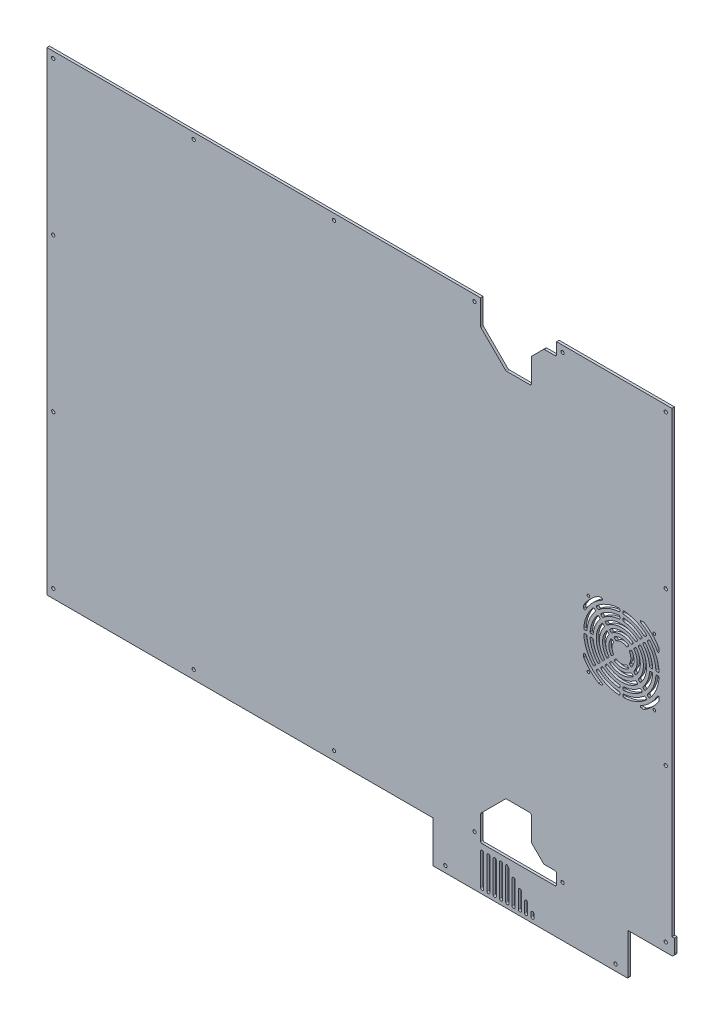
from build123d import *

# Parameters (mm, degrees)
EXTRUDE_1_DEPTH     = 4
CUT_EXTRUDE_6_DEPTH = 1249.406984921
SKETCH_2_R          = 2.6
CUT_EXTRUDE_1_DEPTH = 1249.406984921
CUT_EXTRUDE_2_DEPTH = 1249.406984921
EXTRUDE_2_DEPTH     = 4
SKETCH_4_R          = 2.6
CUT_EXTRUDE_3_DEPTH = 1249.406984921
FILLET_1_R          = 2.5
FILLET_2_R          = 1.5
FILLET_3_R          = 5.5
FILLET_4_R          = 2.5
SKETCH_6_R          = 2.1
CUT_EXTRUDE_5_DEPTH = 1249.406984921
FILLET_5_R          = 1.5


with BuildPart() as part:
    # Эскиз1 → Бобышка-Вытянуть1 (new body)
    with BuildSketch(Plane.XY):
        Polygon((0, -4), (0, 750), (994, 750), (994, 22.45), (998, 22.45), (998, -4), (924, -4), (924, -70), (613.5, -70), (613.5, -4), align=None)
    extrude(amount=EXTRUDE_1_DEPTH)

    # Эскиз7 → Вырез-Вытянуть6 (cut, through all)
    with BuildSketch(Plane.XY.offset(4)):
        Polygon((689.6, -0.4), (810.4, -0.4), (810.4, 20.4), (790.165685425, 20.4), (770.4, 40.165685425), (770.4, 80.4), (729.834314575, 80.4), (689.6, 40.165685425), align=None)
        Polygon((689.6, 750.4), (689.6, 709.834314575), (729.834314575, 669.6), (770.4, 669.6), (770.4, 709.834314575), (790.165685425, 729.6), (810.4, 729.6), (810.4, 750.4), align=None)
    extrude(amount=-CUT_EXTRUDE_6_DEPTH, mode=Mode.SUBTRACT)

    # Эскиз2 → Вырез-Вытянуть1 (cut, through all)
    with BuildSketch(Plane(origin=(0, 0, 0), x_dir=(-1, 0, 0), z_dir=(0, 0, -1))):
        with Locations((-10, 10)):
            Circle(SKETCH_2_R)
        with Locations((-10, 253.33)):
            Circle(SKETCH_2_R)
        with Locations((-10, 496.66)):
            Circle(SKETCH_2_R)
        with Locations((-10, 739.99)):
            Circle(SKETCH_2_R)
        with Locations((-984, 10)):
            Circle(SKETCH_2_R)
        with Locations((-984, 253.33)):
            Circle(SKETCH_2_R)
        with Locations((-984, 496.66)):
            Circle(SKETCH_2_R)
        with Locations((-984, 739.99)):
            Circle(SKETCH_2_R)
        with Locations((-820, 739.99)):
            Circle(SKETCH_2_R)
        with Locations((-820, 10)):
            Circle(SKETCH_2_R)
        with Locations((-233.33, 10)):
            Circle(SKETCH_2_R)
        with Locations((-233.33, 739.99)):
            Circle(SKETCH_2_R)
        with Locations((-456.66, 10)):
            Circle(SKETCH_2_R)
        with Locations((-456.66, 739.99)):
            Circle(SKETCH_2_R)
        with Locations((-679.99, 10)):
            Circle(SKETCH_2_R)
        with Locations((-679.99, 739.99)):
            Circle(SKETCH_2_R)
    extrude(amount=-CUT_EXTRUDE_1_DEPTH, mode=Mode.SUBTRACT)

    # Эскиз3 → Вырез-Вытянуть2 (cut, through all)
    with BuildSketch(Plane.XY.offset(4)):
        with BuildLine():
            Line((774.5, -62), (774.5, -12))
            ThreePointArc((774.5, -12), (772, -9.5), (769.5, -12))
            Line((769.5, -12), (769.5, -62))
            ThreePointArc((769.5, -62), (772, -64.5), (774.5, -62))
        make_face()
        with BuildLine():
            Line((759.5, -12), (759.5, -62))
            ThreePointArc((759.5, -62), (762, -64.5), (764.5, -62))
            Line((764.5, -62), (764.5, -12))
            ThreePointArc((764.5, -12), (762, -9.5), (759.5, -12))
        make_face()
        with BuildLine():
            Line((749.5, -12), (749.5, -62))
            ThreePointArc((749.5, -62), (752, -64.5), (754.5, -62))
            Line((754.5, -62), (754.5, -12))
            ThreePointArc((754.5, -12), (752, -9.5), (749.5, -12))
        make_face()
        with BuildLine():
            Line((739.5, -12), (739.5, -62))
            ThreePointArc((739.5, -62), (742, -64.5), (744.5, -62))
            Line((744.5, -62), (744.5, -12))
            ThreePointArc((744.5, -12), (742, -9.5), (739.5, -12))
        make_face()
        with BuildLine():
            Line((729.5, -12), (729.5, -62))
            ThreePointArc((729.5, -62), (732, -64.5), (734.5, -62))
            Line((734.5, -62), (734.5, -12))
            ThreePointArc((734.5, -12), (732, -9.5), (729.5, -12))
        make_face()
        with BuildLine():
            Line((719.5, -12), (719.5, -62))
            ThreePointArc((719.5, -62), (722, -64.5), (724.5, -62))
            Line((724.5, -62), (724.5, -12))
            ThreePointArc((724.5, -12), (722, -9.5), (719.5, -12))
        make_face()
        with BuildLine():
            Line((709.5, -12), (709.5, -62))
            ThreePointArc((709.5, -62), (712, -64.5), (714.5, -62))
            Line((714.5, -62), (714.5, -12))
            ThreePointArc((714.5, -12), (712, -9.5), (709.5, -12))
        make_face()
        with BuildLine():
            Line((699.5, -12), (699.5, -62))
            ThreePointArc((699.5, -62), (702, -64.5), (704.5, -62))
            Line((704.5, -62), (704.5, -12))
            ThreePointArc((704.5, -12), (702, -9.5), (699.5, -12))
        make_face()
        with BuildLine():
            Line((689.5, -12), (689.5, -62))
            ThreePointArc((689.5, -62), (692, -64.5), (694.5, -62))
            Line((694.5, -62), (694.5, -12))
            ThreePointArc((694.5, -12), (692, -9.5), (689.5, -12))
        make_face()
    extrude(amount=-CUT_EXTRUDE_2_DEPTH, mode=Mode.SUBTRACT)

    # Эскиз5 → Бобышка-Вытянуть2 (add)
    with BuildSketch(Plane.XY.offset(4)):
        Polygon((730, -8), (784.5, -8), (784.5, -66), align=None)
    extrude(amount=-EXTRUDE_2_DEPTH)

    # Эскиз4 → Вырез-Вытянуть3 (cut, through all)
    with BuildSketch(Plane.XY.offset(4)):
        with Locations((904, -60)):
            Circle(SKETCH_4_R)
        with Locations((633.5, -60)):
            Circle(SKETCH_4_R)
    extrude(amount=-CUT_EXTRUDE_3_DEPTH, mode=Mode.SUBTRACT)

    # Скругление1
    fillet_1_edges = [part.edges().sort_by_distance(p)[0] for p in [
        (689.6, -0.4, 2),
        (689.6, 40.165685425, 2),
        (729.834314575, 80.4, 2),
        (770.4, 80.4, 2),
        (770.4, 40.165685425, 2),
        (790.165685425, 20.4, 2),
        (810.4, 20.4, 2),
        (810.4, -0.4, 2),
        (689.6, 709.834314575, 2),
        (810.4, 729.6, 2),
        (790.165685425, 729.6, 2),
        (770.4, 709.834314575, 2),
        (770.4, 669.6, 2),
        (729.834314575, 669.6, 2),
    ]]
    fillet(fillet_1_edges, radius=FILLET_1_R)

    # Скругление2
    fillet_2_edges = [part.edges().sort_by_distance(p)[0] for p in [
        (924, -70, 2),
        (613.5, -70, 2),
    ]]
    fillet(fillet_2_edges, radius=FILLET_2_R)

    # Скругление3
    fillet_3_edges = [part.edges().sort_by_distance(p)[0] for p in [
        (998, -4, 2),
    ]]
    fillet(fillet_3_edges, radius=FILLET_3_R)

    # Скругление4
    fillet_4_edges = [part.edges().sort_by_distance(p)[0] for p in [
        (764.5, -44.71559633, 2),
        (759.5, -39.394495413, 2),
        (754.5, -34.073394495, 2),
        (749.5, -28.752293578, 2),
        (739.5, -18.110091743, 2),
        (744.5, -23.431192661, 2),
        (769.5, -50.036697248, 2),
        (774.5, -55.357798165, 2),
    ]]
    fillet(fillet_4_edges, radius=FILLET_4_R - 0.0001)  # a hair under: the kernel refuses the full size

    # Эскиз6 → Вырез-Вытянуть5 (cut, through all)
    with BuildSketch(Plane.XY.offset(4)):
        with Locations((861, 425.5)):
            Circle(SKETCH_6_R)
        with Locations((966, 425.5)):
            Circle(SKETCH_6_R)
        with Locations((966, 320.5)):
            Circle(SKETCH_6_R)
        with Locations((861, 320.5)):
            Circle(SKETCH_6_R)
        with BuildLine():
            Line((901.273982715, 381.690483379), (897.701017847, 385.263448247))
            ThreePointArc((897.701017847, 385.263448247), (893.5, 373), (897.701017847, 360.736551753))
            Line((897.701017847, 360.736551753), (901.273982715, 364.309516621))
            ThreePointArc((901.273982715, 364.309516621), (898.5, 373), (901.273982715, 381.690483379))
        make_face()
        with BuildLine():
            Line((894.143173948, 388.821292146), (890.59281489, 392.371651204))
            ThreePointArc((890.59281489, 392.371651204), (883.5, 373), (890.59281489, 353.628348796))
            Line((890.59281489, 353.628348796), (894.143173948, 357.178707854))
            ThreePointArc((894.143173948, 357.178707854), (888.5, 373), (894.143173948, 388.821292146))
        make_face()
        with BuildLine():
            Line((887.046710974, 395.91775512), (883.50325857, 399.461207524))
            ThreePointArc((883.50325857, 399.461207524), (873.5, 373), (883.50325857, 346.538792476))
            Line((883.50325857, 346.538792476), (887.046710974, 350.08224488))
            ThreePointArc((887.046710974, 350.08224488), (878.5, 373), (887.046710974, 395.91775512))
        make_face()
        with BuildLine():
            Line((879.961570479, 403.002895615), (876.421115817, 406.543350277))
            ThreePointArc((876.421115817, 406.543350277), (867.306023374, 392.134171618), (863.562539111, 375.5))
            Line((863.562539111, 375.5), (868.569498111, 375.5))
            ThreePointArc((868.569498111, 375.5), (871.925421037, 390.220754456), (879.961570479, 403.002895615))
        make_face()
        with BuildLine():
            Line((879.961570479, 342.997104385), (876.421115817, 339.456649723))
            ThreePointArc((876.421115817, 339.456649723), (867.306023374, 353.865828382), (863.562539111, 370.5))
            Line((863.562539111, 370.5), (868.569498111, 370.5))
            ThreePointArc((868.569498111, 370.5), (871.925421037, 355.779245544), (879.961570479, 342.997104385))
        make_face()
        with BuildLine():
            Line((872.881557377, 410.082908717), (869.342670653, 413.621795442))
            ThreePointArc((869.342670653, 413.621795442), (858.067228049, 395.961005942), (853.552105959, 375.5))
            Line((853.552105959, 375.5), (858.55684756, 375.5))
            ThreePointArc((858.55684756, 375.5), (862.686625712, 394.04758878), (872.881557377, 410.082908717))
        make_face()
        with BuildLine():
            Line((872.881557377, 335.917091283), (869.342670653, 332.378204558))
            ThreePointArc((869.342670653, 332.378204558), (858.067228049, 350.038994058), (853.552105959, 370.5))
            Line((853.552105959, 370.5), (858.55684756, 370.5))
            ThreePointArc((858.55684756, 370.5), (862.686625712, 351.95241122), (872.881557377, 335.917091283))
        make_face()
        with BuildLine():
            Line((853.5, 409.055512755), (853.5, 398))
            ThreePointArc((853.5, 398), (859.492278667, 409.168578026), (867.538059223, 418.961940777))
            ThreePointArc((867.538059223, 418.961940777), (877.331421974, 427.007721333), (888.5, 433))
            Line((888.5, 433), (877.444487245, 433))
            ThreePointArc((877.444487245, 433), (870.402387834, 428.159730108), (864.002525317, 422.497474683))
            ThreePointArc((864.002525317, 422.497474683), (858.340269892, 416.097612166), (853.5, 409.055512755))
        make_face()
        with BuildLine():
            Line((853.5, 348), (853.5, 336.944487245))
            ThreePointArc((853.5, 336.944487245), (858.340269892, 329.902387834), (864.002525317, 323.502525317))
            ThreePointArc((864.002525317, 323.502525317), (870.402387834, 317.840269892), (877.444487245, 313))
            Line((877.444487245, 313), (888.5, 313))
            ThreePointArc((888.5, 313), (877.331421974, 318.992278667), (867.538059223, 327.038059223))
            ThreePointArc((867.538059223, 327.038059223), (859.492278667, 336.831421974), (853.5, 348))
        make_face()
        with BuildLine():
            Line((904.809516621, 385.226017285), (901.236551753, 388.798982153))
            ThreePointArc((901.236551753, 388.798982153), (913.5, 393), (925.763448247, 388.798982153))
            Line((925.763448247, 388.798982153), (922.190483379, 385.226017285))
            ThreePointArc((922.190483379, 385.226017285), (913.5, 388), (904.809516621, 385.226017285))
        make_face()
        with BuildLine():
            Line((929.321292146, 392.356826052), (932.871651204, 395.90718511))
            ThreePointArc((932.871651204, 395.90718511), (913.5, 403), (894.128348796, 395.90718511))
            Line((894.128348796, 395.90718511), (897.678707854, 392.356826052))
            ThreePointArc((897.678707854, 392.356826052), (913.5, 398), (929.321292146, 392.356826052))
        make_face()
        with BuildLine():
            Line((936.41775512, 399.453289026), (939.961207524, 402.99674143))
            ThreePointArc((939.961207524, 402.99674143), (913.5, 413), (887.038792476, 402.99674143))
            Line((887.038792476, 402.99674143), (890.58224488, 399.453289026))
            ThreePointArc((890.58224488, 399.453289026), (913.5, 408), (936.41775512, 399.453289026))
        make_face()
        with BuildLine():
            Line((916, 422.937460889), (916, 417.930501889))
            ThreePointArc((916, 417.930501889), (930.720754456, 414.574578963), (943.502895615, 406.538429521))
            Line((943.502895615, 406.538429521), (947.043350277, 410.078884183))
            ThreePointArc((947.043350277, 410.078884183), (932.634171618, 419.193976626), (916, 422.937460889))
        make_face()
        with BuildLine():
            Line((950.582908717, 413.618442623), (954.121795442, 417.157329347))
            ThreePointArc((954.121795442, 417.157329347), (936.461005942, 428.432771951), (916, 432.947894041))
            Line((916, 432.947894041), (916, 427.94315244))
            ThreePointArc((916, 427.94315244), (934.54758878, 423.813374288), (950.582908717, 413.618442623))
        make_face()
        with BuildLine():
            Line((883.497104385, 406.538429521), (879.956649723, 410.078884183))
            ThreePointArc((879.956649723, 410.078884183), (894.365828382, 419.193976626), (911, 422.937460889))
            Line((911, 422.937460889), (911, 417.930501889))
            ThreePointArc((911, 417.930501889), (896.279245544, 414.574578963), (883.497104385, 406.538429521))
        make_face()
        with BuildLine():
            Line((876.417091283, 413.618442623), (872.878204558, 417.157329347))
            ThreePointArc((872.878204558, 417.157329347), (890.538994058, 428.432771951), (911, 432.947894041))
            Line((911, 432.947894041), (911, 427.94315244))
            ThreePointArc((911, 427.94315244), (892.45241122, 423.813374288), (876.417091283, 413.618442623))
        make_face()
        with BuildLine():
            Line((949.555512755, 433), (938.5, 433))
            ThreePointArc((938.5, 433), (949.668578026, 427.007721333), (959.461940777, 418.961940777))
            ThreePointArc((959.461940777, 418.961940777), (967.507721333, 409.168578026), (973.5, 398))
            Line((973.5, 398), (973.5, 409.055512755))
            ThreePointArc((973.5, 409.055512755), (968.659730108, 416.097612166), (962.997474683, 422.497474683))
            ThreePointArc((962.997474683, 422.497474683), (956.597612166, 428.159730108), (949.555512755, 433))
        make_face()
        with BuildLine():
            Line((925.726017285, 381.690483379), (929.298982153, 385.263448247))
            ThreePointArc((929.298982153, 385.263448247), (933.5, 373), (929.298982153, 360.736551753))
            Line((929.298982153, 360.736551753), (925.726017285, 364.309516621))
            ThreePointArc((925.726017285, 364.309516621), (928.5, 373), (925.726017285, 381.690483379))
        make_face()
        with BuildLine():
            Line((932.856826052, 357.178707854), (936.40718511, 353.628348796))
            ThreePointArc((936.40718511, 353.628348796), (943.5, 373), (936.40718511, 392.371651204))
            Line((936.40718511, 392.371651204), (932.856826052, 388.821292146))
            ThreePointArc((932.856826052, 388.821292146), (938.5, 373), (932.856826052, 357.178707854))
        make_face()
        with BuildLine():
            Line((939.953289026, 350.08224488), (943.49674143, 346.538792476))
            ThreePointArc((943.49674143, 346.538792476), (953.5, 373), (943.49674143, 399.461207524))
            Line((943.49674143, 399.461207524), (939.953289026, 395.91775512))
            ThreePointArc((939.953289026, 395.91775512), (948.5, 373), (939.953289026, 350.08224488))
        make_face()
        with BuildLine():
            Line((963.437460889, 370.5), (958.430501889, 370.5))
            ThreePointArc((958.430501889, 370.5), (955.074578963, 355.779245544), (947.038429521, 342.997104385))
            Line((947.038429521, 342.997104385), (950.578884183, 339.456649723))
            ThreePointArc((950.578884183, 339.456649723), (959.693976626, 353.865828382), (963.437460889, 370.5))
        make_face()
        with BuildLine():
            Line((954.118442623, 335.917091283), (957.657329347, 332.378204558))
            ThreePointArc((957.657329347, 332.378204558), (968.932771951, 350.038994058), (973.447894041, 370.5))
            Line((973.447894041, 370.5), (968.44315244, 370.5))
            ThreePointArc((968.44315244, 370.5), (964.313374288, 351.95241122), (954.118442623, 335.917091283))
        make_face()
        with BuildLine():
            Line((947.038429521, 403.002895615), (950.578884183, 406.543350277))
            ThreePointArc((950.578884183, 406.543350277), (959.693976626, 392.134171618), (963.437460889, 375.5))
            Line((963.437460889, 375.5), (958.430501889, 375.5))
            ThreePointArc((958.430501889, 375.5), (955.074578963, 390.220754456), (947.038429521, 403.002895615))
        make_face()
        with BuildLine():
            Line((954.118442623, 410.082908717), (957.657329347, 413.621795442))
            ThreePointArc((957.657329347, 413.621795442), (968.932771951, 395.961005942), (973.447894041, 375.5))
            Line((973.447894041, 375.5), (968.44315244, 375.5))
            ThreePointArc((968.44315244, 375.5), (964.313374288, 394.04758878), (954.118442623, 410.082908717))
        make_face()
        with BuildLine():
            Line((973.5, 336.944487245), (973.5, 348))
            ThreePointArc((973.5, 348), (967.507721333, 336.831421974), (959.461940777, 327.038059223))
            ThreePointArc((959.461940777, 327.038059223), (949.668578026, 318.992278667), (938.5, 313))
            Line((938.5, 313), (949.555512755, 313))
            ThreePointArc((949.555512755, 313), (956.597612166, 317.840269892), (962.997474683, 323.502525317))
            ThreePointArc((962.997474683, 323.502525317), (968.659730108, 329.902387834), (973.5, 336.944487245))
        make_face()
        with BuildLine():
            Line((922.190483379, 360.773982715), (925.763448247, 357.201017847))
            ThreePointArc((925.763448247, 357.201017847), (913.5, 353), (901.236551753, 357.201017847))
            Line((901.236551753, 357.201017847), (904.809516621, 360.773982715))
            ThreePointArc((904.809516621, 360.773982715), (913.5, 358), (922.190483379, 360.773982715))
        make_face()
        with BuildLine():
            Line((897.678707854, 353.643173948), (894.128348796, 350.09281489))
            ThreePointArc((894.128348796, 350.09281489), (913.5, 343), (932.871651204, 350.09281489))
            Line((932.871651204, 350.09281489), (929.321292146, 353.643173948))
            ThreePointArc((929.321292146, 353.643173948), (913.5, 348), (897.678707854, 353.643173948))
        make_face()
        with BuildLine():
            Line((890.58224488, 346.546710974), (887.038792476, 343.00325857))
            ThreePointArc((887.038792476, 343.00325857), (913.5, 333), (939.961207524, 343.00325857))
            Line((939.961207524, 343.00325857), (936.41775512, 346.546710974))
            ThreePointArc((936.41775512, 346.546710974), (913.5, 338), (890.58224488, 346.546710974))
        make_face()
        with BuildLine():
            Line((911, 323.062539111), (911, 328.069498111))
            ThreePointArc((911, 328.069498111), (896.279245544, 331.425421037), (883.497104385, 339.461570479))
            Line((883.497104385, 339.461570479), (879.956649723, 335.921115817))
            ThreePointArc((879.956649723, 335.921115817), (894.365828382, 326.806023374), (911, 323.062539111))
        make_face()
        with BuildLine():
            Line((876.417091283, 332.381557377), (872.878204558, 328.842670653))
            ThreePointArc((872.878204558, 328.842670653), (890.538994058, 317.567228049), (911, 313.052105959))
            Line((911, 313.052105959), (911, 318.05684756))
            ThreePointArc((911, 318.05684756), (892.45241122, 322.186625712), (876.417091283, 332.381557377))
        make_face()
        with BuildLine():
            Line((943.502895615, 339.461570479), (947.043350277, 335.921115817))
            ThreePointArc((947.043350277, 335.921115817), (932.634171618, 326.806023374), (916, 323.062539111))
            Line((916, 323.062539111), (916, 328.069498111))
            ThreePointArc((916, 328.069498111), (930.720754456, 331.425421037), (943.502895615, 339.461570479))
        make_face()
        with BuildLine():
            Line((950.582908717, 332.381557377), (954.121795442, 328.842670653))
            ThreePointArc((954.121795442, 328.842670653), (936.461005942, 317.567228049), (916, 313.052105959))
            Line((916, 313.052105959), (916, 318.05684756))
            ThreePointArc((916, 318.05684756), (934.54758878, 322.186625712), (950.582908717, 332.381557377))
        make_face()
    extrude(amount=-CUT_EXTRUDE_5_DEPTH, mode=Mode.SUBTRACT)

    # Скругление5
    fillet_5_edges = [part.edges().sort_by_distance(p)[0] for p in [
        (973.447894041, 370.5, 2),
        (957.657329347, 332.378204558, 2),
        (954.118442623, 335.917091283, 2),
        (968.44315244, 370.5, 2),
        (957.657329347, 413.621795442, 2),
        (973.447894041, 375.5, 2),
        (968.44315244, 375.5, 2),
        (954.118442623, 410.082908717, 2),
        (973.5, 336.944487245, 2),
        (949.555512755, 313, 2),
        (938.5, 313, 2),
        (973.5, 348, 2),
        (929.298982153, 385.263448247, 2),
        (929.298982153, 360.736551753, 2),
        (925.726017285, 364.309516621, 2),
        (925.726017285, 381.690483379, 2),
        (936.40718511, 392.371651204, 2),
        (936.40718511, 353.628348796, 2),
        (932.856826052, 357.178707854, 2),
        (932.856826052, 388.821292146, 2),
        (939.953289026, 350.08224488, 2),
        (939.953289026, 395.91775512, 2),
        (943.49674143, 399.461207524, 2),
        (943.49674143, 346.538792476, 2),
        (911, 417.930501889, 2),
        (883.497104385, 406.538429521, 2),
        (879.956649723, 410.078884183, 2),
        (911, 422.937460889, 2),
        (890.58224488, 346.546710974, 2),
        (936.41775512, 346.546710974, 2),
        (939.961207524, 343.00325857, 2),
        (887.038792476, 343.00325857, 2),
        (911, 313.052105959, 2),
        (872.878204558, 328.842670653, 2),
        (876.417091283, 332.381557377, 2),
        (911, 318.05684756, 2),
        (954.121795442, 328.842670653, 2),
        (916, 313.052105959, 2),
        (916, 318.05684756, 2),
        (950.582908717, 332.381557377, 2),
        (925.763448247, 357.201017847, 2),
        (901.236551753, 357.201017847, 2),
        (904.809516621, 360.773982715, 2),
        (922.190483379, 360.773982715, 2),
        (963.437460889, 370.5, 2),
        (950.578884183, 339.456649723, 2),
        (947.038429521, 342.997104385, 2),
        (958.430501889, 370.5, 2),
        (958.430501889, 375.5, 2),
        (947.038429521, 403.002895615, 2),
        (950.578884183, 406.543350277, 2),
        (963.437460889, 375.5, 2),
        (932.871651204, 350.09281489, 2),
        (894.128348796, 350.09281489, 2),
        (897.678707854, 353.643173948, 2),
        (929.321292146, 353.643173948, 2),
        (853.5, 409.055512755, 2),
        (877.444487245, 433, 2),
        (888.5, 433, 2),
        (853.5, 398, 2),
        (897.701017847, 360.736551753, 2),
        (897.701017847, 385.263448247, 2),
        (901.273982715, 381.690483379, 2),
        (901.273982715, 364.309516621, 2),
        (863.562539111, 375.5, 2),
        (876.421115817, 406.543350277, 2),
        (879.961570479, 403.002895615, 2),
        (868.569498111, 375.5, 2),
        (868.569498111, 370.5, 2),
        (879.961570479, 342.997104385, 2),
        (876.421115817, 339.456649723, 2),
        (863.562539111, 370.5, 2),
        (877.444487245, 313, 2),
        (853.5, 336.944487245, 2),
        (853.5, 348, 2),
        (888.5, 313, 2),
        (887.046710974, 395.91775512, 2),
        (887.046710974, 350.08224488, 2),
        (883.50325857, 346.538792476, 2),
        (883.50325857, 399.461207524, 2),
        (853.552105959, 375.5, 2),
        (869.342670653, 413.621795442, 2),
        (872.881557377, 410.082908717, 2),
        (858.55684756, 375.5, 2),
        (869.342670653, 332.378204558, 2),
        (853.552105959, 370.5, 2),
        (858.55684756, 370.5, 2),
        (872.881557377, 335.917091283, 2),
        (872.878204558, 417.157329347, 2),
        (911, 432.947894041, 2),
        (911, 427.94315244, 2),
        (876.417091283, 413.618442623, 2),
        (949.555512755, 433, 2),
        (973.5, 409.055512755, 2),
        (973.5, 398, 2),
        (938.5, 433, 2),
        (901.236551753, 388.798982153, 2),
        (925.763448247, 388.798982153, 2),
        (922.190483379, 385.226017285, 2),
        (904.809516621, 385.226017285, 2),
        (916, 422.937460889, 2),
        (947.043350277, 410.078884183, 2),
        (943.502895615, 406.538429521, 2),
        (916, 417.930501889, 2),
        (894.128348796, 395.90718511, 2),
        (932.871651204, 395.90718511, 2),
        (929.321292146, 392.356826052, 2),
        (897.678707854, 392.356826052, 2),
        (936.41775512, 399.453289026, 2),
        (890.58224488, 399.453289026, 2),
        (887.038792476, 402.99674143, 2),
        (939.961207524, 402.99674143, 2),
        (916, 432.947894041, 2),
        (954.121795442, 417.157329347, 2),
        (950.582908717, 413.618442623, 2),
        (916, 427.94315244, 2),
        (911, 323.062539111, 2),
        (879.956649723, 335.921115817, 2),
        (883.497104385, 339.461570479, 2),
        (911, 328.069498111, 2),
        (916, 328.069498111, 2),
        (943.502895615, 339.461570479, 2),
        (947.043350277, 335.921115817, 2),
        (916, 323.062539111, 2),
        (890.59281489, 353.628348796, 2),
        (890.59281489, 392.371651204, 2),
        (894.143173948, 388.821292146, 2),
        (894.143173948, 357.178707854, 2),
    ]]
    fillet(fillet_5_edges, radius=FILLET_5_R)


solid = part.part
